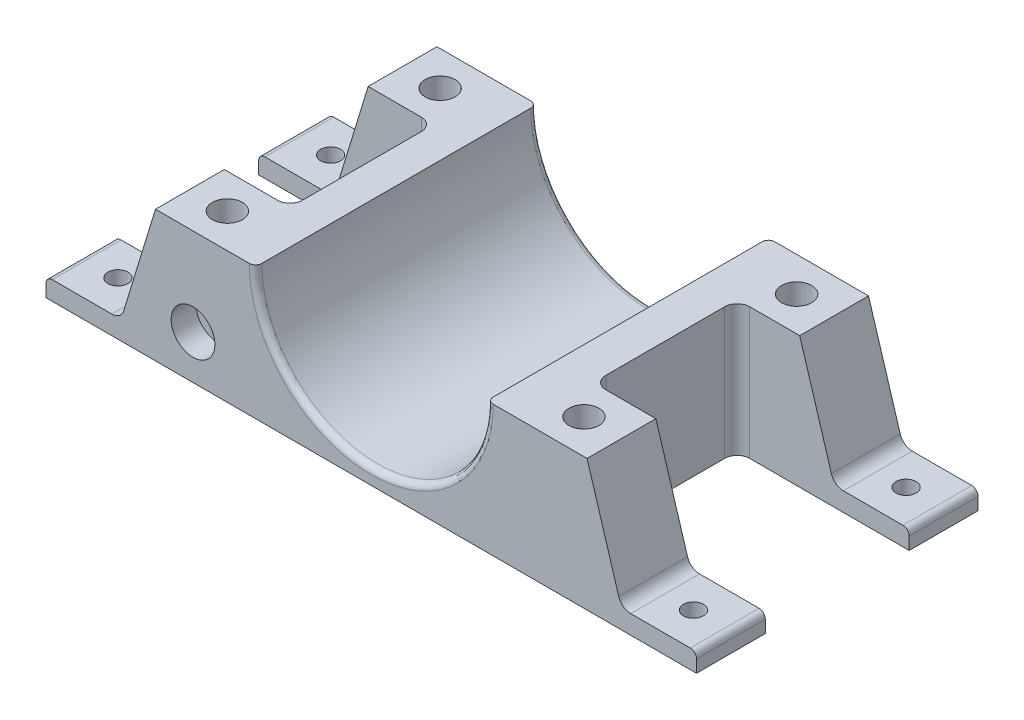
from build123d import *

# Parameters (mm, degrees)
BOSS_EXTRUDE1_DEPTH        = 22.5
SKETCH2_W                  = 28
SKETCH2_H                  = 23
SKETCH2_W_2                = 27.5
CUT_EXTRUDE1_DEPTH         = 65
SKETCH3_R                  = 1.6
CUT_EXTRUDE2_DEPTH         = 65
SKETCH4_R                  = 3.5
BEARING_HOLE_DEPTH         = 4
AXLE_THRU_HOLES_DEPTH      = 70.469417732
AXLE_THRU_HOLES_DEPTH_BACK = 70.469417732
SKETCH5_R                  = 1.5
FILLET2_R                  = 1
FILLET3_R                  = 2
TOP_MOUNT_HOLES_DEPTH      = 61.425574056
TOP_MOUNT_HOLES_DEPTH_BACK = 7
SKETCH6_R                  = 2.4
FILLET4_R                  = 2


with BuildPart() as part:
    # Sketch1 → Boss-Extrude1 (new, symmetric)
    with BuildSketch(Plane.XY):
        with BuildLine():
            Line((-18.5, 0), (-34.5, 0))
            Line((-34.5, 0), (-40, -18))
            Line((-40, -18), (-52, -18))
            Line((-52, -18), (-52, -21))
            Line((-52, -21), (0, -21))
            Line((0, -21), (52, -21))
            Line((52, -21), (52, -18))
            Line((52, -18), (40, -18))
            Line((40, -18), (34.5, 0))
            Line((34.5, 0), (18.5, 0))
            ThreePointArc((18.5, 0), (0, -18.5), (-18.5, 0))
        make_face()
    extrude(amount=BOSS_EXTRUDE1_DEPTH, both=True)

    # Sketch2 → Cut-Extrude1 (cut)
    with BuildSketch(Plane(origin=(0, 0, 0), x_dir=(1, 0, 0), z_dir=(0, 1, 0))):
        with Locations((-38, 0)):
            Rectangle(SKETCH2_W, SKETCH2_H)
        with Locations((38.25, 0)):
            Rectangle(SKETCH2_W_2, SKETCH2_H)
    extrude(amount=-CUT_EXTRUDE1_DEPTH, mode=Mode.SUBTRACT)

    # Sketch3 → Cut-Extrude2 (cut)
    with BuildSketch(Plane(origin=(0, -18, 0), x_dir=(1, 0, 0), z_dir=(0, 1, 0))):
        with Locations((-46, 17)):
            Circle(SKETCH3_R)
        with Locations((46, 17)):
            Circle(SKETCH3_R)
        with Locations((46, -17)):
            Circle(SKETCH3_R)
        with Locations((-46, -17)):
            Circle(SKETCH3_R)
    extrude(amount=-CUT_EXTRUDE2_DEPTH, mode=Mode.SUBTRACT)

    # Sketch4 → Bearing-Hole (cut)
    with BuildSketch(Plane.XY.offset(22.5)):
        with Locations((-28.5, -14)):
            Circle(SKETCH4_R)
    bearing_hole = extrude(amount=-BEARING_HOLE_DEPTH, mode=Mode.SUBTRACT)

    # Mirror1: Bearing-Hole across plane
    add(bearing_hole.mirror(Plane.XY), mode=Mode.SUBTRACT)

    # Sketch5 → Axle-Thru-Holes (cut, two sides: drawn at the far end of the back side and taken through both)
    with BuildSketch(Plane.XY.offset(18.5).offset(-AXLE_THRU_HOLES_DEPTH_BACK)):
        with Locations((-28.5, -14)):
            Circle(SKETCH5_R)
    extrude(amount=AXLE_THRU_HOLES_DEPTH + AXLE_THRU_HOLES_DEPTH_BACK, mode=Mode.SUBTRACT)

    # Fillet2
    fillet2_edges = [part.edges().sort_by_distance(p)[0] for p in [
        (0, -18.5, -22.5),
        (0, -18.5, 22.5),
        (52, -18, -17),
        (52, -18, 17),
        (-52, -18, -17),
        (-52, -18, 17),
    ]]
    fillet(fillet2_edges, radius=FILLET2_R)

    # Fillet3
    fillet3_edges = [part.edges().sort_by_distance(p)[0] for p in [
        (24.5, -10.5, -11.5),
        (24.5, -10.5, 11.5),
        (-24, -10.5, 11.5),
        (-24, -10.5, -11.5),
    ]]
    fillet(fillet3_edges, radius=FILLET3_R)

    # Sketch6 → Top-Mount-Holes (cut, two sides: drawn at the far end of the back side and taken through both)
    with BuildSketch(Plane(origin=(0, 0, 0), x_dir=(1, 0, 0), z_dir=(0, 1, 0)).offset(-TOP_MOUNT_HOLES_DEPTH_BACK)):
        with Locations((-28.5, 17)):
            Circle(SKETCH6_R)
        with Locations((28.5, 17)):
            Circle(SKETCH6_R)
        with Locations((28.5, -17)):
            Circle(SKETCH6_R)
        with Locations((-28.5, -17)):
            Circle(SKETCH6_R)
    extrude(amount=TOP_MOUNT_HOLES_DEPTH + TOP_MOUNT_HOLES_DEPTH_BACK, mode=Mode.SUBTRACT)

    # Fillet4
    fillet4_edges = [part.edges().sort_by_distance(p)[0] for p in [
        (40, -18, -17),
        (40, -18, 17),
        (-40, -18, 17),
        (-40, -18, -17),
    ]]
    fillet(fillet4_edges, radius=FILLET4_R)


solid = part.part
